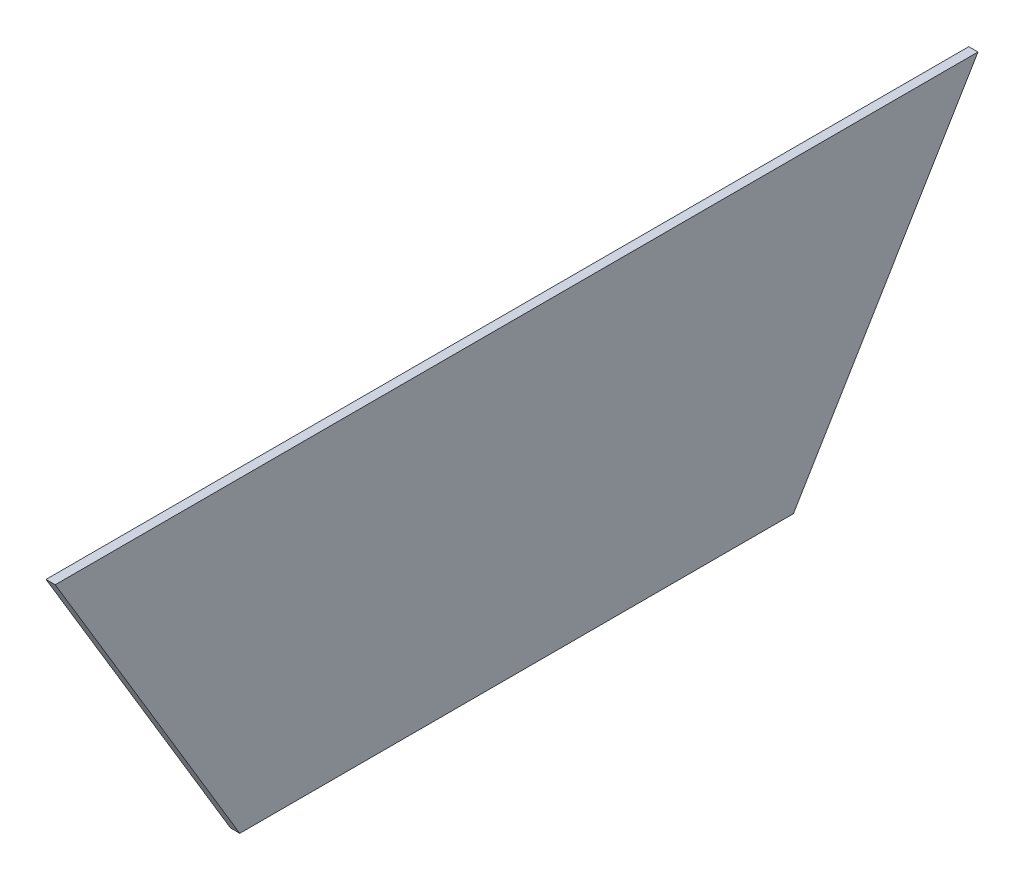
from build123d import *

# Parameters (mm, degrees)
SM_BASE_FLANGE_1_DEPTH = 3


# Sheet-metal steps are written as plain solids
with BuildPart() as part:
    # Sketch 1 → Базовая кромка1 (new body)
    with BuildSketch(Plane(origin=(0, 0, 0), x_dir=(0, 0, -1), z_dir=(1, 0, 0))):
        Polygon((-90, 0), (90, 0), (150, 100), (-150, 100), align=None)
    extrude(amount=-SM_BASE_FLANGE_1_DEPTH)


solid = part.part
